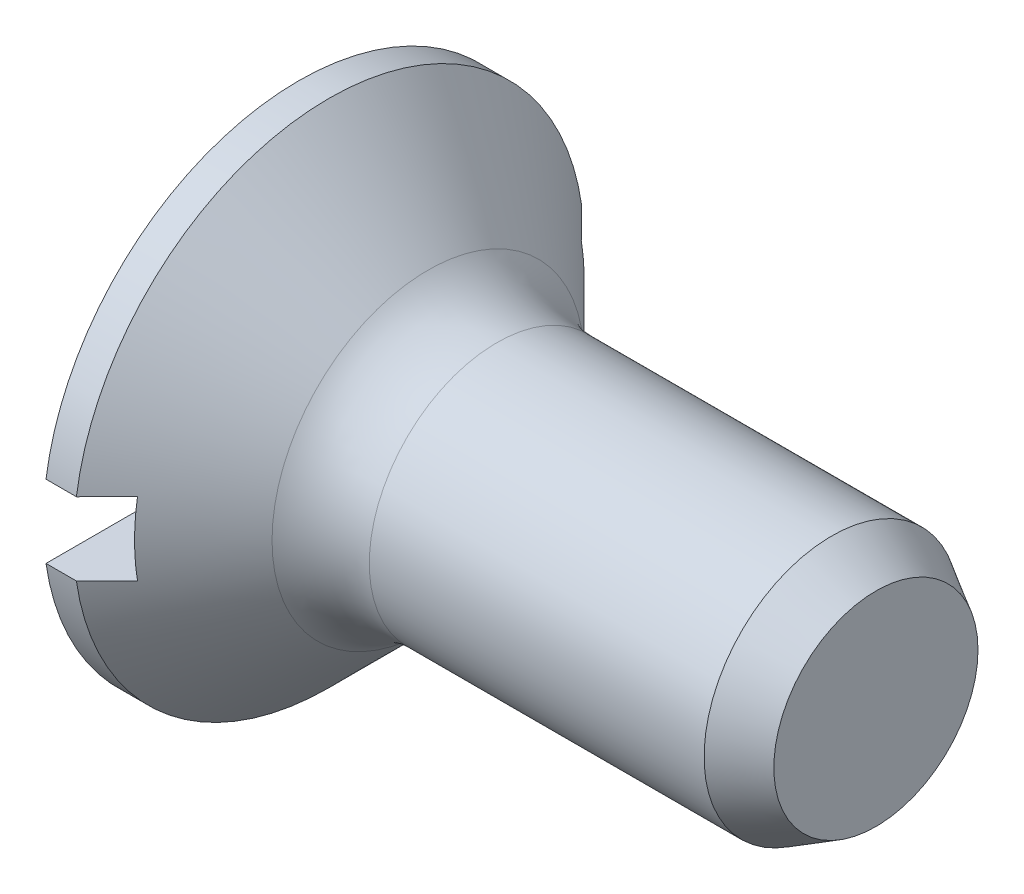
from build123d import *

# Parameters (mm, degrees)
CUT_EXTRUDE1_DEPTH      = 12.204017137
CUT_EXTRUDE1_DEPTH_BACK = 12.204017137
SKETCH2_W               = 1
SKETCH2_H               = 1.2
CHAMFER1_SIZE           = 0.42
CHAMFER1_SIZE2          = 0.727461339
FILLET1_R               = 1.6


with BuildPart() as part:
    # Sketch1 → Revolve1 (revolve)
    with BuildSketch(Plane.XY):
        Polygon((0, 4.2), (0.5, 4.2), (2.6, 2.1), (9.5, 2.1), (9.5, 0), (0, 0), align=None)
    revolve(axis=Axis((6.620684694, 0, 0), (-1, 0, 0)))

    # Sketch2 → Cut-Extrude1 (cut, two sides: drawn at the far end of the back side and taken through both)
    with BuildSketch(Plane.XY.offset(-CUT_EXTRUDE1_DEPTH_BACK)):
        with Locations((0.5, 0)):
            Rectangle(SKETCH2_W, SKETCH2_H)
    extrude(amount=CUT_EXTRUDE1_DEPTH + CUT_EXTRUDE1_DEPTH_BACK, mode=Mode.SUBTRACT)

    # Chamfer1
    chamfer1_edges = [part.edges().sort_by_distance(p)[0] for p in [
        (9.5, -2.1, 0),
    ]]
    chamfer1_side = [part.faces().sort_by_distance(p)[0] for p in [
        (9.5, 0, 0),
    ]]
    chamfer(chamfer1_edges, length=CHAMFER1_SIZE, length2=CHAMFER1_SIZE2, reference=chamfer1_side[0])

    # Fillet1
    fillet1_edges = [part.edges().sort_by_distance(p)[0] for p in [
        (2.6, -2.1, 0),
    ]]
    fillet(fillet1_edges, radius=FILLET1_R)


solid = part.part
